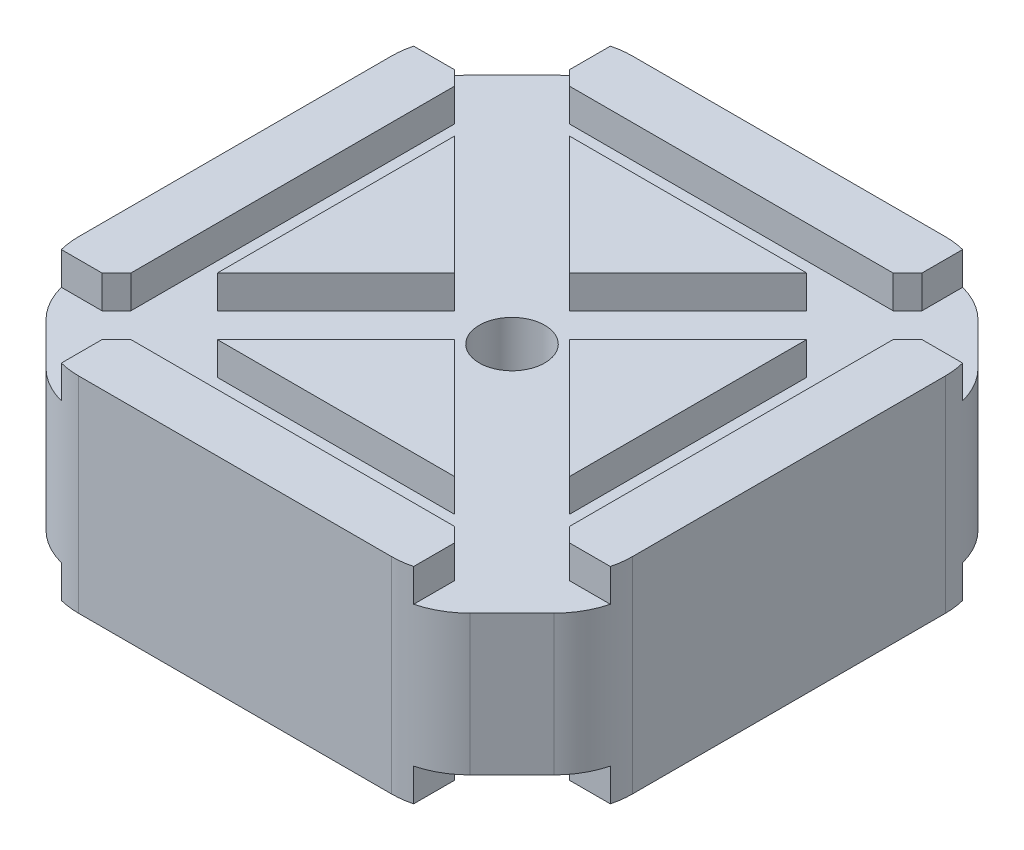
from build123d import *

# Parameters (mm, degrees)
BOSS_EXTRUDE1_DEPTH = 7.85
SKETCH18_W          = 3.3
SKETCH18_H          = 2.5
CUT_EXTRUDE10_DEPTH = 48.939910304
SKETCH19_W          = 3.3
SKETCH19_H          = 2.5
CUT_EXTRUDE11_DEPTH = 48.939910304
SKETCH20_W          = 6.221233688
SKETCH20_H          = 2.5
CUT_EXTRUDE12_DEPTH = 58.251345511
SKETCH21_W          = 6.221233688
SKETCH21_H          = 2.5
CUT_EXTRUDE13_DEPTH = 58.251345511
SKETCH22_R          = 2.5
CUT_EXTRUDE14_DEPTH = 31.385317178
CUT_EXTRUDE15_DEPTH = 33.693806753
FILLET8_R           = 6


with BuildPart() as part:
    # Sketch1 → Boss-Extrude1 (new body)
    with BuildSketch(Plane(origin=(0, 0, 0), x_dir=(1, 0, 0), z_dir=(0, 1, 0))):
        Polygon((-21.15, 16.750923472), (-16.750923472, 21.15), (16.750923472, 21.15), (21.15, 16.750923472), (21.15, -16.750923472), (16.750923472, -21.15), (-16.750923472, -21.15), (-21.15, -16.750923472), align=None)
    boss_extrude1 = extrude(amount=BOSS_EXTRUDE1_DEPTH)

    # Sketch18 → Cut-Extrude10 (cut, through all)
    with BuildSketch(Plane.XY.offset(21.15)):
        with Locations((15.100923472, 6.6)):
            Rectangle(SKETCH18_W, SKETCH18_H)
        with Locations((-15.100923472, 6.6)):
            Rectangle(SKETCH18_W, SKETCH18_H)
    cut_extrude10 = extrude(amount=-CUT_EXTRUDE10_DEPTH, mode=Mode.SUBTRACT)

    # Sketch19 → Cut-Extrude11 (cut, through all)
    with BuildSketch(Plane(origin=(21.15, 0, 0), x_dir=(0, 0, -1), z_dir=(1, 0, 0))):
        with Locations((-15.100923472, 6.6)):
            Rectangle(SKETCH19_W, SKETCH19_H)
        with Locations((15.100923472, 6.6)):
            Rectangle(SKETCH19_W, SKETCH19_H)
    cut_extrude11 = extrude(amount=-CUT_EXTRUDE11_DEPTH, mode=Mode.SUBTRACT)

    # Sketch20 → Cut-Extrude12 (cut, through all)
    with BuildSketch(Plane(origin=(18.950461736, 0, 18.950461736), x_dir=(0.707106781186546, 0, -0.707106781186549), z_dir=(0.707106781186549, 0, 0.707106781186546))):
        with Locations((0, 6.6)):
            Rectangle(SKETCH20_W, SKETCH20_H)
    cut_extrude12 = extrude(amount=-CUT_EXTRUDE12_DEPTH, mode=Mode.SUBTRACT)

    # Sketch21 → Cut-Extrude13 (cut, through all)
    with BuildSketch(Plane(origin=(-18.950461736, 0, 18.950461736), x_dir=(0.7071067811865422, 0, 0.7071067811865528), z_dir=(-0.7071067811865528, 0, 0.7071067811865422))):
        with Locations((0, 6.6)):
            Rectangle(SKETCH21_W, SKETCH21_H)
    cut_extrude13 = extrude(amount=-CUT_EXTRUDE13_DEPTH, mode=Mode.SUBTRACT)

    # Sketch22 → Cut-Extrude14 (cut, through all)
    with BuildSketch(Plane(origin=(0, 5.35, 0), x_dir=(1, 0, 0), z_dir=(0, 1, 0))):
        Circle(SKETCH22_R)
    cut_extrude14 = extrude(amount=-CUT_EXTRUDE14_DEPTH, mode=Mode.SUBTRACT)

    # Mirror1: Boss-Extrude1, Cut-Extrude10, Cut-Extrude11, Cut-Extrude12, Cut-Extrude13, Cut-Extrude14 across plane
    add(boss_extrude1.mirror(Plane(origin=(0, 0, 0), x_dir=(0, 0, 1), z_dir=(0, -1, 0))))
    add(cut_extrude10.mirror(Plane(origin=(0, 0, 0), x_dir=(0, 0, 1), z_dir=(0, -1, 0))), mode=Mode.SUBTRACT)
    add(cut_extrude11.mirror(Plane(origin=(0, 0, 0), x_dir=(0, 0, 1), z_dir=(0, -1, 0))), mode=Mode.SUBTRACT)
    add(cut_extrude12.mirror(Plane(origin=(0, 0, 0), x_dir=(0, 0, 1), z_dir=(0, -1, 0))), mode=Mode.SUBTRACT)
    add(cut_extrude13.mirror(Plane(origin=(0, 0, 0), x_dir=(0, 0, 1), z_dir=(0, -1, 0))), mode=Mode.SUBTRACT)
    add(cut_extrude14.mirror(Plane(origin=(0, 0, 0), x_dir=(0, 0, 1), z_dir=(0, -1, 0))), mode=Mode.SUBTRACT)

    # Sketch23 → Cut-Extrude15 (cut, through all)
    with BuildSketch(Plane(origin=(0, 5.35, 0), x_dir=(1, 0, 0), z_dir=(0, 1, 0))):
        Polygon((-21.15, -14.432485579), (-14.432485579, -21.15), (-16.750923472, -21.15), (-21.15, -16.750923472), align=None)
        Polygon((-21.15, 14.432485579), (-14.432485579, 21.15), (-16.750923472, 21.15), (-21.15, 16.750923472), align=None)
        Polygon((14.432485579, 21.15), (21.15, 14.432485579), (21.15, 16.750923472), (16.750923472, 21.15), align=None)
        Polygon((14.432485579, -21.15), (21.15, -14.432485579), (21.15, -16.750923472), (16.750923472, -21.15), align=None)
    extrude(amount=-CUT_EXTRUDE15_DEPTH, mode=Mode.SUBTRACT)

    # Fillet8
    fillet8_edges = [part.edges().sort_by_distance(p)[0] for p in [
        (14.432485579, 0, -21.15),
        (21.15, 0, -14.432485579),
        (-21.15, 0, -14.432485579),
        (-14.432485579, 0, -21.15),
        (-14.432485579, 0, 21.15),
        (-21.15, 0, 14.432485579),
        (21.15, 0, 14.432485579),
        (14.432485579, 0, 21.15),
    ]]
    fillet(fillet8_edges, radius=FILLET8_R)


solid = part.part
